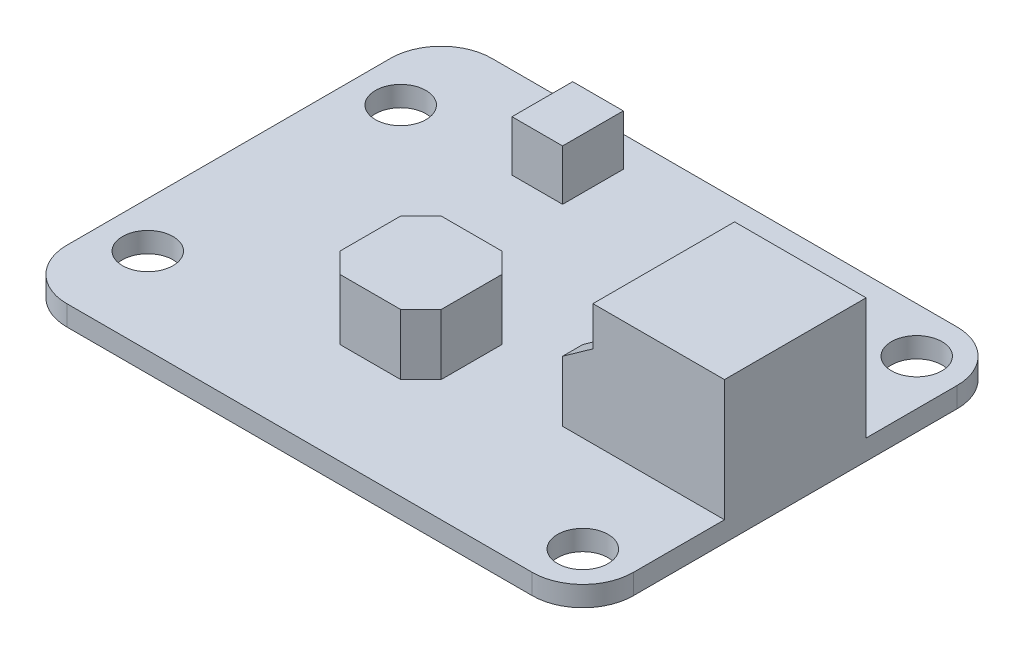
from build123d import *

# Parameters (mm, degrees)
CROQUIS1_R              = 1.25
SALIENTE_EXTRUIR1_DEPTH = 1
SALIENTE_EXTRUIR2_DEPTH = 6
CORTAR_EXTRUIR1_DEPTH   = 22
SALIENTE_EXTRUIR3_DEPTH = 3
CROQUIS5_W              = 2.5
CROQUIS5_H              = 3
SALIENTE_EXTRUIR4_DEPTH = 2.5


with BuildPart() as part:
    # Croquis1 → Saliente-Extruir1 (new body)
    with BuildSketch(Plane(origin=(0, 0, 0), x_dir=(1, 0, 0), z_dir=(0, 1, 0))):
        with BuildLine():
            Line((-11.5, -10.5), (11.5, -10.5))
            ThreePointArc((11.5, -10.5), (13.267766953, -9.767766953), (14, -8))
            Line((14, -8), (14, 8))
            ThreePointArc((14, 8), (13.267766953, 9.767766953), (11.5, 10.5))
            Line((11.5, 10.5), (-11.5, 10.5))
            ThreePointArc((-11.5, 10.5), (-13.267766953, 9.767766953), (-14, 8))
            Line((-14, 8), (-14, -8))
            ThreePointArc((-14, -8), (-13.267766953, -9.767766953), (-11.5, -10.5))
        make_face()
        with Locations((11.75, -8.25)):
            Circle(CROQUIS1_R, mode=Mode.SUBTRACT)
        with Locations((11.75, 8.25)):
            Circle(CROQUIS1_R, mode=Mode.SUBTRACT)
        with Locations((-11.75, 6.25)):
            Circle(CROQUIS1_R, mode=Mode.SUBTRACT)
        with Locations((-11.75, -6.25)):
            Circle(CROQUIS1_R, mode=Mode.SUBTRACT)
    extrude(amount=SALIENTE_EXTRUIR1_DEPTH)

    # Croquis2 → Saliente-Extruir2 (add)
    with BuildSketch(Plane(origin=(0, 1, 0), x_dir=(1, 0, 0), z_dir=(0, 1, 0))):
        Polygon((14, -3.5), (6, -3.5), (6, -2.5), (7.5, -2.5), (7.5, 2.5), (6, 2.5), (6, 3.5), (14, 3.5), align=None)
    extrude(amount=SALIENTE_EXTRUIR2_DEPTH)

    # Croquis3 → Cortar-Extruir1 (cut, through all)
    with BuildSketch(Plane.XY.offset(3.5)):
        Polygon((7.5, 7), (7.5, 5.064017175), (6, 4), (6, 7), align=None)
    extrude(amount=-CORTAR_EXTRUIR1_DEPTH, mode=Mode.SUBTRACT)

    # Croquis4 → Saliente-Extruir3 (add)
    with BuildSketch(Plane(origin=(0, 1, 0), x_dir=(1, 0, 0), z_dir=(0, 1, 0))):
        Polygon((-3, -5.5), (0, -5.5), (1, -4.5), (1, -1.5), (0, -0.5), (-3, -0.5), (-4, -1.5), (-4, -4.5), align=None)
    extrude(amount=SALIENTE_EXTRUIR3_DEPTH)

    # Croquis5 → Saliente-Extruir4 (add)
    with BuildSketch(Plane(origin=(0, 1, 0), x_dir=(1, 0, 0), z_dir=(0, 1, 0))):
        with Locations((-4.75, 7.5)):
            Rectangle(CROQUIS5_W, CROQUIS5_H)
    extrude(amount=SALIENTE_EXTRUIR4_DEPTH)


solid = part.part
